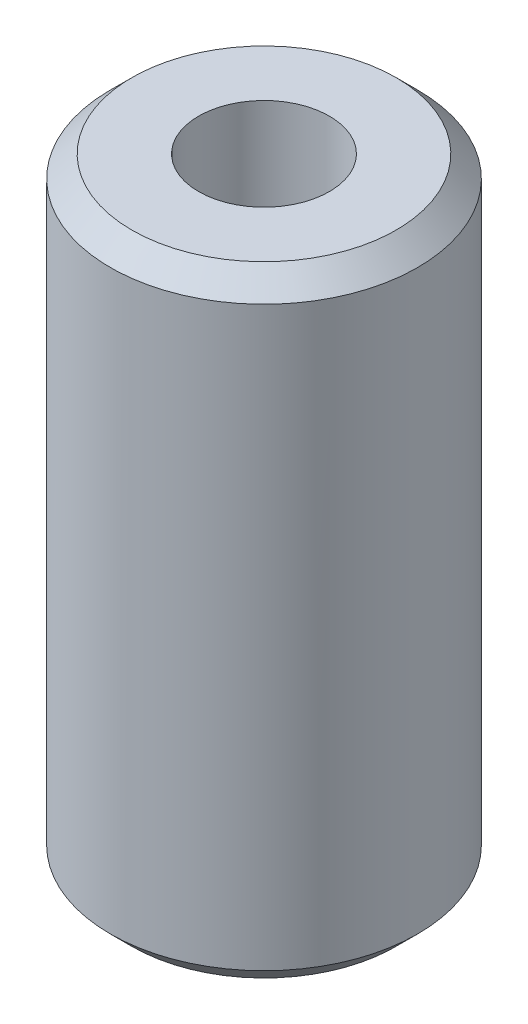
from build123d import *

# Parameters (mm, degrees)
SKETCH1_R           = 27.5
BOSS_EXTRUDE1_DEPTH = 110.983095502
SKETCH2_R           = 11.700687052
CUT_EXTRUDE1_DEPTH  = 118.5999468
CHAMFER1_SIZE       = 3.860823431


with BuildPart() as part:
    # Sketch1 → Boss-Extrude1 (new body)
    with BuildSketch(Plane(origin=(0, 0, 0), x_dir=(1, 0, 0), z_dir=(0, 1, 0))):
        Circle(SKETCH1_R)
    extrude(amount=BOSS_EXTRUDE1_DEPTH)

    # Sketch2 → Cut-Extrude1 (cut, through all)
    with BuildSketch(Plane(origin=(0, 0, 0), x_dir=(1, 0, 0), z_dir=(0, 1, 0))):
        Circle(SKETCH2_R)
    extrude(amount=CUT_EXTRUDE1_DEPTH, mode=Mode.SUBTRACT)

    # Chamfer1
    chamfer1_edges = [part.edges().sort_by_distance(p)[0] for p in [
        (-27.5, 110.983095502, 0),
        (-27.5, 0, 0),
    ]]
    chamfer(chamfer1_edges, length=CHAMFER1_SIZE)


solid = part.part
